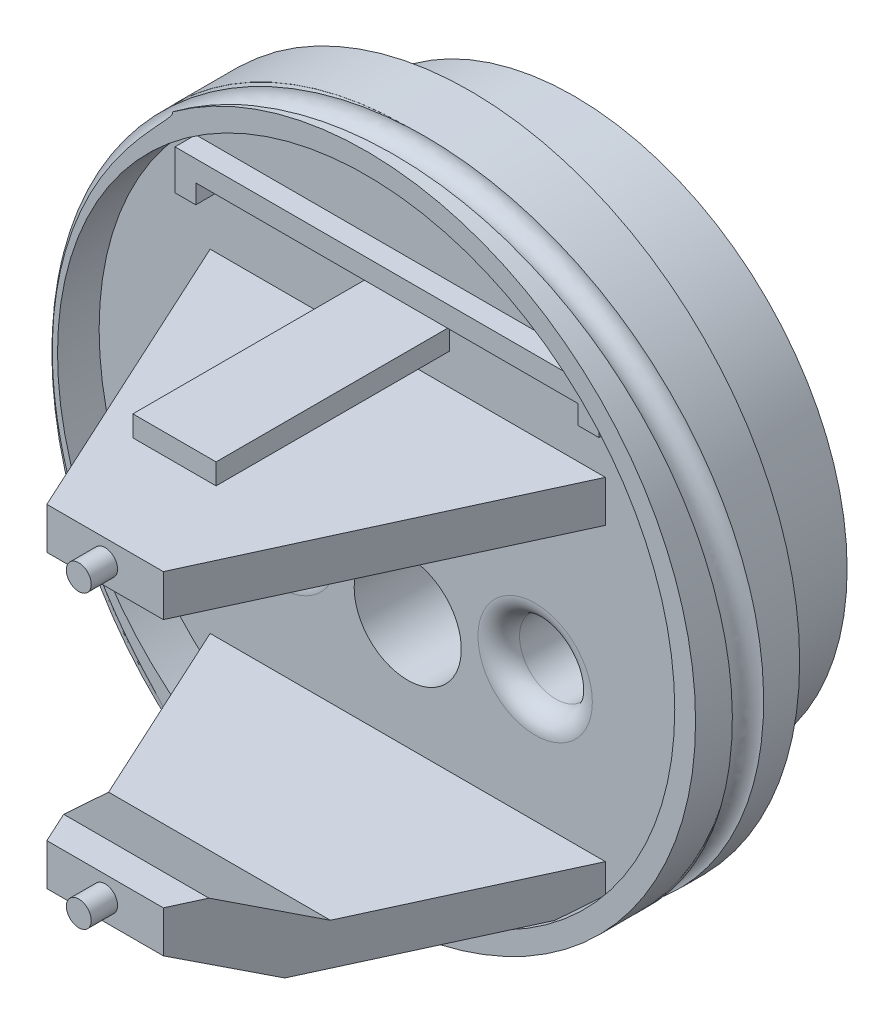
from build123d import *
from OCP.BRepFilletAPI import BRepFilletAPI_MakeChamfer

# Parameters (mm, degrees)
SKETCH1_R               = 31.685
BOSS_EXTRUDE1_DEPTH     = 6
SKETCH3_R               = 26.25
BOSS_EXTRUDE2_DEPTH     = 10
CUT_EXTRUDE1_DEPTH      = 46.911637414
CUT_EXTRUDE1_DEPTH_BACK = 46.911637414
SKETCH2_R               = 3.5
SKETCH2_R_2             = 5.15
SKETCH6_W               = 38
SKETCH6_H               = 4
BOSS_EXTRUDE3_DEPTH     = 29.1
CUT_EXTRUDE2_DEPTH      = 65.376458818
BOSS_EXTRUDE5_DEPTH     = 4
CHAMFER1_SIZE           = 8
CHAMFER1_SIZE_2         = 4
FILLET3_R               = 2
SKETCH13_W              = 8
SKETCH13_H              = 2
BOSS_EXTRUDE8_DEPTH     = 22.43
BOSS_EXTRUDE9_DEPTH     = 2
SKETCH17_R              = 1.2
BOSS_EXTRUDE10_DEPTH    = 2.53
SKETCH18_R              = 31.675084614
SKETCH18_R_2            = 29.675084614
BOSS_EXTRUDE11_DEPTH    = 4
CUT_SWEEP1_PITCH        = 10


with BuildPart() as part:
    # Sketch1 → Boss-Extrude1 (new body)
    with BuildSketch(Plane.XY):
        Circle(SKETCH1_R)
    extrude(amount=BOSS_EXTRUDE1_DEPTH)

    # Sketch3 → Boss-Extrude2 (add)
    with BuildSketch(Plane(origin=(0, 0, 0), x_dir=(-1, 0, 0), z_dir=(0, 0, -1))):
        Circle(SKETCH3_R)
    extrude(amount=BOSS_EXTRUDE2_DEPTH)

    # Sketch2 → Cut-Extrude1 (cut, two sides: drawn at the far end of the back side and taken through both)
    with BuildSketch(Plane(origin=(0, 0, 0), x_dir=(-1, 0, 0), z_dir=(0, 0, -1)).offset(-CUT_EXTRUDE1_DEPTH_BACK)):
        with Locations((-12.25, -7.348382475)):
            Circle(SKETCH2_R)
        with Locations((12.25, -7.348382475)):
            Circle(SKETCH2_R)
        with Locations((0, -9.25)):
            Circle(SKETCH2_R_2)
    extrude(amount=CUT_EXTRUDE1_DEPTH + CUT_EXTRUDE1_DEPTH_BACK, mode=Mode.SUBTRACT)

    # Sketch6 → Boss-Extrude3 (add)
    with BuildSketch(Plane.XY.offset(6)):
        with Locations((0, -22)):
            Rectangle(SKETCH6_W, SKETCH6_H)
        with Locations((0, 10)):
            Rectangle(SKETCH6_W, SKETCH6_H)
    extrude(amount=BOSS_EXTRUDE3_DEPTH)

    # Sketch7 → Cut-Extrude2 (cut, through all)
    with BuildSketch(Plane(origin=(0, 12, 0), x_dir=(1, 0, 0), z_dir=(0, 1, 0))):
        Polygon((-19, -6), (-5.6, -35.1), (-19, -35.1), align=None)
        Polygon((19, -6), (5.6, -35.1), (19, -35.1), align=None)
    extrude(amount=-CUT_EXTRUDE2_DEPTH, mode=Mode.SUBTRACT)

    # Sketch9 → Boss-Extrude5 (add)
    with BuildSketch(Plane(origin=(0, -20, 0), x_dir=(1, 0, 0), z_dir=(0, 1, 0))):
        Polygon((-6.981443299, -32.1), (6.981443299, -32.1), (5.6, -35.1), (-5.6, -35.1), align=None)
    extrude(amount=BOSS_EXTRUDE5_DEPTH)

    # Chamfer1
    chamfer1_edges_1 = [part.edges().sort_by_distance(p)[0] for p in [
        (0, -20, 32.1),
    ]]
    chamfer1_side_1 = [part.faces().sort_by_distance(p)[0] for p in [
        (0, -20, 32.02),
    ]]
    chamfer1_edges_2 = [part.edges().sort_by_distance(p)[0] for p in [
        (0, -24, 35.1),
    ]]
    chamfer1_side_2 = [part.faces().sort_by_distance(p)[0] for p in [
        (0, -23.92, 35.1),
    ]]
    chamfer1 = BRepFilletAPI_MakeChamfer(part.part.solid().wrapped)
    for e in chamfer1_edges_1:
        chamfer1.Add(CHAMFER1_SIZE - 0.0001, CHAMFER1_SIZE_2 - 0.0001, e.wrapped, chamfer1_side_1[0].wrapped)
    for e in chamfer1_edges_2:
        chamfer1.Add(CHAMFER1_SIZE_2 - 0.0001, CHAMFER1_SIZE - 0.0001, e.wrapped, chamfer1_side_2[0].wrapped)
    add(Compound.cast(chamfer1.Shape()), mode=Mode.REPLACE)  # a hair under: the kernel refuses the full size

    # Fillet3
    fillet3_edges = [part.edges().sort_by_distance(p)[0] for p in [
        (-8.75, -7.348382475, 6),
        (15.75, -7.348382475, 6),
    ]]
    fillet(fillet3_edges, radius=FILLET3_R)

    # Sketch13 → Boss-Extrude8 (add)
    with BuildSketch(Plane.XY.offset(6)):
        with Locations((0, 16)):
            Rectangle(SKETCH13_W, SKETCH13_H)
    extrude(amount=BOSS_EXTRUDE8_DEPTH)

    # Sketch14 → Boss-Extrude9 (add)
    with BuildSketch(Plane.XY.offset(6)):
        Polygon((-18.38, 18.83), (18.38, 18.83), (18.38, 17), (20.38, 17), (20.38, 20.83), (18.38, 20.83), (-18.38, 20.83), (-20.38, 20.83), (-20.38, 17), (-18.38, 17), align=None)
    extrude(amount=BOSS_EXTRUDE9_DEPTH)

    # Sketch17 → Boss-Extrude10 (add)
    with BuildSketch(Plane.XY.offset(35.1)):
        with Locations((0, 10)):
            Circle(SKETCH17_R)
        with Locations((0, -18)):
            Circle(SKETCH17_R)
    extrude(amount=BOSS_EXTRUDE10_DEPTH)

    # Sketch18 → Boss-Extrude11 (add)
    with BuildSketch(Plane.XY.offset(6)):
        Circle(SKETCH18_R)
        with Locations(Location((0, 0, 0), (0, 0, 230.188211297))):
            Circle(SKETCH18_R_2, mode=Mode.SUBTRACT)
    extrude(amount=BOSS_EXTRUDE11_DEPTH)

    # Cut-Sweep1: arcs per turn and ends read off the stored shape
    # Cut-Sweep1: the profile of Sketch20 screwed along a right-hand helix through 3 turns, 16 arcs to a turn; built about Z, then put on its axis
    cut_sweep1_z = Axis((0, 0, 0), (0, 0, 1))
    cut_sweep1_corners = [(30.175084614, -2.1066e-05, -1.111e-06), (31.675084614, -2.2113e-05, -1.500001111), (33.175084614, -2.3161e-05, -1.111e-06), (31.675084614, -2.2113e-05, 1.499998889)]
    with BuildLine(mode=Mode.PRIVATE) as cut_sweep1_profile:
        ThreePointArc((30.175084614, -2.1066e-05, -1.111e-06), (30.614424442, -2.1373e-05, -1.060661283), (31.675084614, -2.2113e-05, -1.500001111))
        ThreePointArc((31.675084614, -2.2113e-05, -1.500001111), (32.735744786, -2.2854e-05, -1.060661283), (33.175084614, -2.3161e-05, -1.111e-06))
        ThreePointArc((33.175084614, -2.3161e-05, -1.111e-06), (32.735744786, -2.2854e-05, 1.060659061), (31.675084614, -2.2113e-05, 1.499998889))
        ThreePointArc((31.675084614, -2.2113e-05, 1.499998889), (30.614424442, -2.1373e-05, 1.060659061), (30.175084614, -2.1066e-05, -1.111e-06))
    cut_sweep1_cap = Face(cut_sweep1_profile.wire())
    cut_sweep1_arcs = [((30.175084614, -2.1066e-05, -1.111e-06), (30.175084614, -2.1066e-05, -1.500001111), (31.675084614, -2.2113e-05, -1.500001111), (1, 0.7071067811865476, 1)), ((31.675084614, -2.2113e-05, -1.500001111), (33.175084614, -2.3161e-05, -1.500001111), (33.175084614, -2.3161e-05, -1.111e-06), (1, 0.7071067811865476, 1)), ((33.175084614, -2.3161e-05, -1.111e-06), (33.175084614, -2.3161e-05, 1.499998889), (31.675084614, -2.2113e-05, 1.499998889), (1, 0.7071067811865476, 1)), ((31.675084614, -2.2113e-05, 1.499998889), (30.175084614, -2.1066e-05, 1.499998889), (30.175084614, -2.1066e-05, -1.111e-06), (1, 0.7071067811865476, 1))]  # start, shoulder, end, weights
    cut_sweep1_turn_angles = [0, 11.25, 22.5, 33.75, 45, 56.25, 67.5, 78.75, 90, 101.25, 112.5, 123.75, 135, 146.25, 157.5, 168.75, 180, 191.25, 202.5, 213.75, 225, 236.25, 247.5, 258.75, 270, 281.25, 292.5, 303.75, 315, 326.25, 337.5, 348.75, 360]
    cut_sweep1_turn_weights = [1, 0.9807852804032304, 1, 0.9807852804032304, 1, 0.9807852804032304, 1, 0.9807852804032304, 1, 0.9807852804032304, 1, 0.9807852804032304, 1, 0.9807852804032304, 1, 0.9807852804032304, 1, 0.9807852804032304, 1, 0.9807852804032304, 1, 0.9807852804032304, 1, 0.9807852804032304, 1, 0.9807852804032304, 1, 0.9807852804032304, 1, 0.9807852804032304, 1, 0.9807852804032304, 1]
    cut_sweep1_turn_sides = [Face.make_bezier_surface([[Vector(p[j][0], p[j][1], 0).rotate(cut_sweep1_z, cut_sweep1_turn_angles[2 * i + k]) / cut_sweep1_turn_weights[2 * i + k] + Vector(0, 0, p[j][2] + CUT_SWEEP1_PITCH * cut_sweep1_turn_angles[2 * i + k] / 360) for k in range(3)] for j in range(3)], [[p[3][j] * cut_sweep1_turn_weights[2 * i + k] for k in range(3)] for j in range(3)]) for p in cut_sweep1_arcs for i in range(16)]
    cut_sweep1 = Plane(origin=(0, 0, -10), x_dir=(-1, 0, 0), z_dir=(0, 0, 1)) * Solid(Shell([*[p.moved(Location((0, 0, CUT_SWEEP1_PITCH * i))) for i in range(3) for p in cut_sweep1_turn_sides], cut_sweep1_cap, cut_sweep1_cap.rotate(cut_sweep1_z, 1080).moved(Location((0, 0, CUT_SWEEP1_PITCH * 1080 / 360)))]))
    add(cut_sweep1, mode=Mode.SUBTRACT)


solid = part.part
